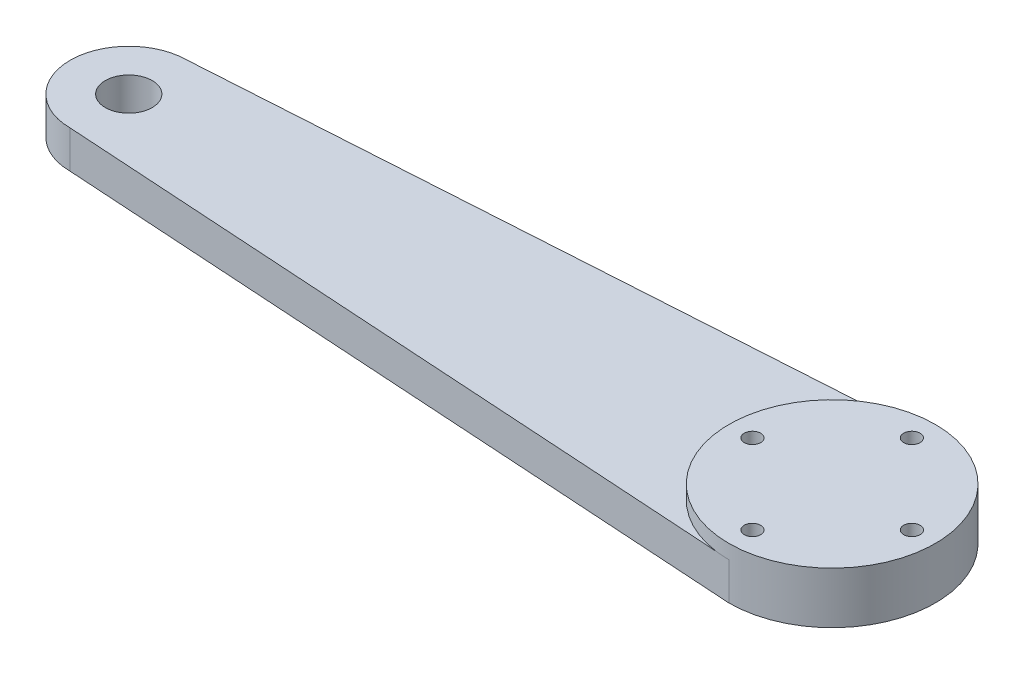
from build123d import *
from build123d.topology import SkipClean

# Parameters (mm, degrees)
SKETCH1_R           = 1.75
SKETCH1_R_2         = 5
BOSS_EXTRUDE1_DEPTH = 8
SKETCH2_R           = 22
SKETCH2_R_2         = 1.75
BOSS_EXTRUDE2_DEPTH = 3
SKETCH3_R           = 3.25
SKETCH3_R_2         = 1.75
CUT_EXTRUDE1_DEPTH  = 4


with BuildPart() as part:
    # Sketch1 → Boss-Extrude1 (new body)
    with BuildSketch(Plane(origin=(0, 0, 0), x_dir=(1, 0, 0), z_dir=(0, 1, 0))):
        with BuildLine():
            Line((-150, 12.5), (0, 22))
            ThreePointArc((0, 22), (22, 0), (0, -22))
            Line((0, -22), (-150, -12.5))
            ThreePointArc((-150, -12.5), (-162.5, 0), (-150, 12.5))
        make_face()
        with Locations((0, 17)):
            Circle(SKETCH1_R, mode=Mode.SUBTRACT)
        with Locations((17, 0)):
            Circle(SKETCH1_R, mode=Mode.SUBTRACT)
        with Locations((0, -17)):
            Circle(SKETCH1_R, mode=Mode.SUBTRACT)
        with Locations((-17, 0)):
            Circle(SKETCH1_R, mode=Mode.SUBTRACT)
        with Locations((-150, 0)):
            Circle(SKETCH1_R_2, mode=Mode.SUBTRACT)
    extrude(amount=BOSS_EXTRUDE1_DEPTH)

    # Sketch2 → Boss-Extrude2 (add)
    with SkipClean():  # the faces are left unmerged after this step: merging them gives an invalid solid
        with BuildSketch(Plane(origin=(0, 8, 0), x_dir=(1, 0, 0), z_dir=(0, 1, 0))):
            Circle(SKETCH2_R)
            with Locations((-17, 0)):
                Circle(SKETCH2_R_2, mode=Mode.SUBTRACT)
            with Locations((0, -17)):
                Circle(SKETCH2_R_2, mode=Mode.SUBTRACT)
            with Locations((17, 0)):
                Circle(SKETCH2_R_2, mode=Mode.SUBTRACT)
            with Locations((0, 17)):
                Circle(SKETCH2_R_2, mode=Mode.SUBTRACT)
        extrude(amount=BOSS_EXTRUDE2_DEPTH)
    add(part.part.scale(1), mode=Mode.REPLACE)  # the faces are merged on a copy

    # Sketch3 → Cut-Extrude1 (cut)
    # profile 1 of 4: a face of its own
    with BuildSketch(Plane(origin=(0, 0, 0), x_dir=(-1, 0, 0), z_dir=(0, -1, 0))):
        with Locations((0, 17)):
            Circle(SKETCH3_R)
        with Locations((0, 17)):
            Circle(SKETCH3_R_2, mode=Mode.SUBTRACT)
    # profile 2 of 4: a face of its own
    with BuildSketch(Plane(origin=(0, 0, 0), x_dir=(-1, 0, 0), z_dir=(0, -1, 0))):
        with Locations((-17, 0)):
            Circle(SKETCH3_R)
        with Locations((-17, 0)):
            Circle(SKETCH3_R_2, mode=Mode.SUBTRACT)
    # profile 3 of 4: a face of its own
    with BuildSketch(Plane(origin=(0, 0, 0), x_dir=(-1, 0, 0), z_dir=(0, -1, 0))):
        with Locations((0, -17)):
            Circle(SKETCH3_R)
        with Locations((0, -17)):
            Circle(SKETCH3_R_2, mode=Mode.SUBTRACT)
    # profile 4 of 4: a face of its own
    with BuildSketch(Plane(origin=(0, 0, 0), x_dir=(-1, 0, 0), z_dir=(0, -1, 0))):
        with Locations((17, 0)):
            Circle(SKETCH3_R)
        with Locations((17, 0)):
            Circle(SKETCH3_R_2, mode=Mode.SUBTRACT)
    extrude(amount=-CUT_EXTRUDE1_DEPTH, mode=Mode.SUBTRACT)


solid = part.part
